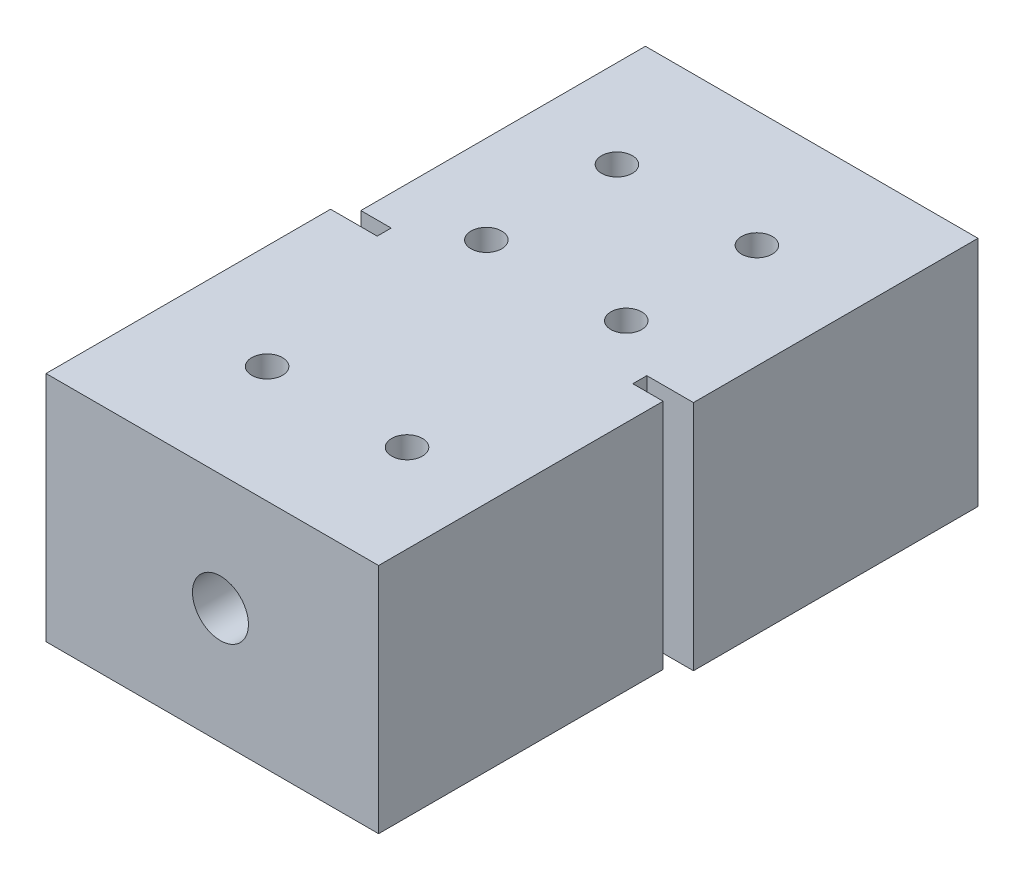
from build123d import *

# Parameters (mm, degrees)
SKETCH1_W                 = 74.8
SKETCH1_H                 = 49.8
SLIDER_BODY_DEPTH         = 125
SKETCH2_R                 = 11
LEAD_NUT_INSET_DEPTH      = 15
SKETCH3_R                 = 6
LEADSCREW_CLEARANCE_DEPTH = 143.039008726
SKETCH9_W                 = 10
SKETCH9_H                 = 3
DECOUPLING_SLIT_DEPTH     = 154.948303011
BOLT_CLEARANCE_HOLES_D    = 6.6
SKETCH10_W                = 3.5
SKETCH10_H                = 61
NEOPRENE_INLAY_DEPTH      = 154.948303011


with BuildPart() as part:
    # Sketch1 → slider body (new body)
    with BuildSketch(Plane.XY):
        with Locations((37.4, 24.9)):
            Rectangle(SKETCH1_W, SKETCH1_H)
    extrude(amount=SLIDER_BODY_DEPTH)

    # Sketch2 → lead nut inset (cut)
    with BuildSketch(Plane(origin=(0, 0, 0), x_dir=(-1, 0, 0), z_dir=(0, 0, -1))):
        with Locations((-37.4, 24.9)):
            Circle(SKETCH2_R)
    extrude(amount=-LEAD_NUT_INSET_DEPTH, mode=Mode.SUBTRACT)

    # Sketch3 → leadscrew clearance (cut, through all)
    with BuildSketch(Plane(origin=(0, 0, 15), x_dir=(-1, 0, 0), z_dir=(0, 0, -1))):
        with Locations((-37.4, 24.9)):
            Circle(SKETCH3_R)
    extrude(amount=-LEADSCREW_CLEARANCE_DEPTH, mode=Mode.SUBTRACT)

    # Sketch9 → decoupling slit (cut, through all)
    with BuildSketch(Plane.XZ):
        with Locations((69.8, 62.5)):
            Rectangle(SKETCH9_W, SKETCH9_H)
    decoupling_slit = extrude(amount=-DECOUPLING_SLIT_DEPTH, mode=Mode.SUBTRACT)

    # bolt clearance holes (through all)
    with Locations(Plane(origin=(0, 49.8, 0), x_dir=(1, 0, 0), z_dir=(0, 1, 0))):
        with Locations((52.4, -100), (22.4, -25), (52.4, -25), (22.4, -100), (22.4, -53), (52.4, -53)):
            Hole(BOLT_CLEARANCE_HOLES_D / 2)

    # mirror slit: decoupling slit across plane
    add(decoupling_slit.mirror(Plane.ZY.offset(-37.4)), mode=Mode.SUBTRACT)

    # Sketch10 → neoprene inlay (cut, through all)
    with BuildSketch(Plane.XZ):
        with Locations((73.05, 94.5)):
            Rectangle(SKETCH10_W, SKETCH10_H)
        with Locations((1.75, 30.5)):
            Rectangle(SKETCH10_W, SKETCH10_H)
    extrude(amount=-NEOPRENE_INLAY_DEPTH, mode=Mode.SUBTRACT)


solid = part.part
